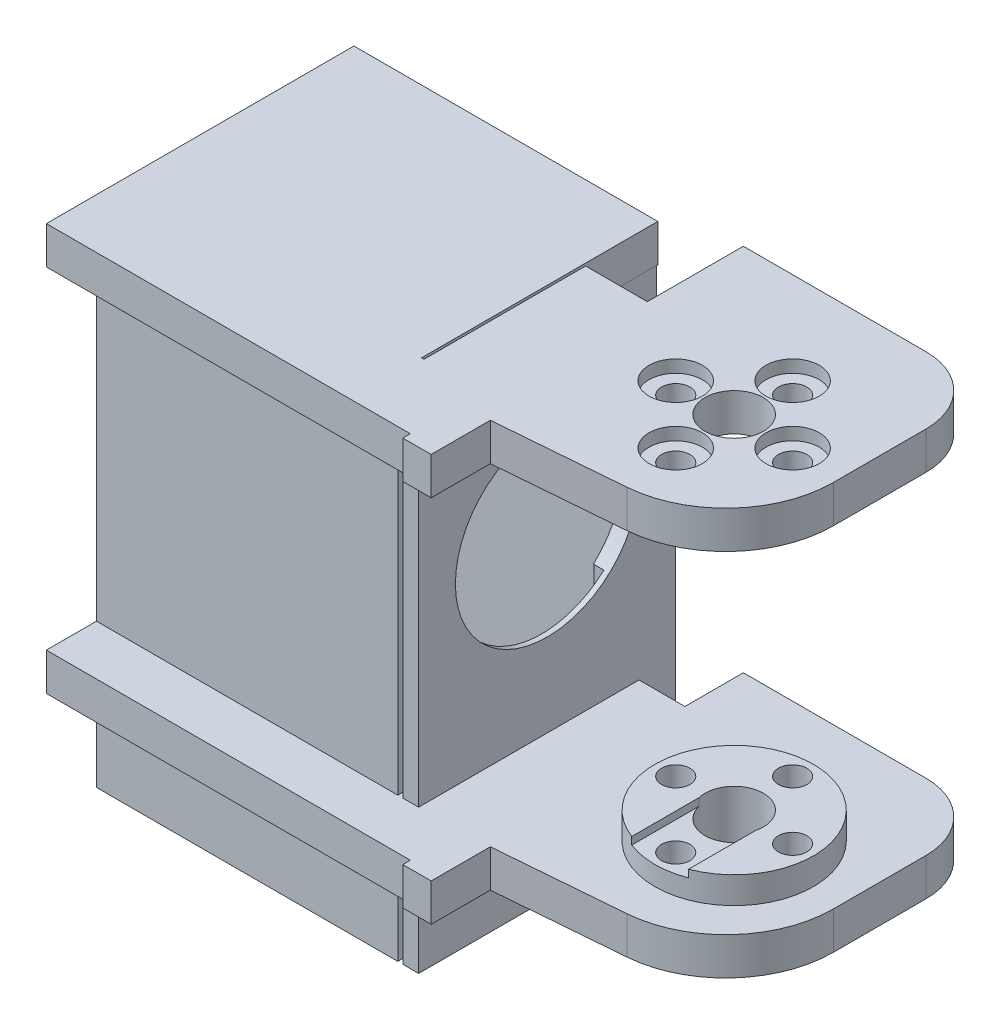
from build123d import *

# Parameters (mm, degrees)
BOSS_1_DEPTH    = 4.5
S_CYL2_R        = 9.5
BOSS_2_DEPTH    = 3.2
BOSS_3_DEPTH    = 4.5
S_PRISM4_W      = 7.5
S_PRISM4_H      = 21.95
BOSS_4_DEPTH    = 4.5
S_PRISM5_W      = 44.2
S_PRISM5_H      = 8.55
BOSS_5_DEPTH    = 4.5
S_PRISM6_W      = 36.4
S_PRISM6_H      = 30.9
BOSS_6_DEPTH    = 4.5
S_PRISM7_W      = 3.4
S_PRISM7_H      = 7.9
BOSS_7_DEPTH    = 4.5
S_PRISM8_W      = 7.5
S_PRISM8_H      = 26.45
BOSS_8_DEPTH    = 4.5
S_PRISM9_W      = 44.2
S_PRISM9_H      = 8.55
BOSS_9_DEPTH    = 4.5
S_PRISM10_W     = 3.4
S_PRISM10_H     = 7.9
BOSS_10_DEPTH   = 4.5
S_BOX11_W       = 36.1
S_BOX11_H       = 2.5
BOSS_11_DEPTH   = 30.8
S_BOX12_W       = 36.1
S_BOX12_H       = 51.4
BOSS_12_DEPTH   = 2.5
S_BOX13_W       = 36.1
S_BOX13_H       = 51.4
BOSS_13_DEPTH   = 2.5
S_BOX14_W       = 4.6
S_BOX14_H       = 51.4
BOSS_14_DEPTH   = 30.8
S_BOX15_W       = 1.9
S_BOX15_H       = 54.1
BOSS_15_DEPTH   = 30.8
S_BOX16_W       = 36.26
S_BOX16_H       = 6
BOSS_16_DEPTH   = 30.76
S_HOLE17_R      = 3.5
HOLE_17_DEPTH   = 4.7
S_HOLE18_R      = 1.7
HOLE_18_DEPTH   = 4.7
S_HOLE19_R      = 1.7
HOLE_19_DEPTH   = 4.7
S_HOLE20_R      = 1.7
HOLE_20_DEPTH   = 4.7
S_HOLE21_R      = 1.7
HOLE_21_DEPTH   = 4.7
S_HOLE22_R      = 3.2
HOLE_22_DEPTH   = 1.6
S_HOLE23_R      = 3.2
HOLE_23_DEPTH   = 1.6
S_HOLE24_R      = 3.2
HOLE_24_DEPTH   = 1.6
S_HOLE25_R      = 3.2
HOLE_25_DEPTH   = 1.6
S_HOLE26_R      = 3.5
HOLE_26_DEPTH   = 7.9
S_HOLE27_R      = 1.7
HOLE_27_DEPTH   = 7.9
S_HOLE28_R      = 1.7
HOLE_28_DEPTH   = 7.9
S_HOLE29_R      = 1.7
HOLE_29_DEPTH   = 7.9
S_HOLE30_R      = 1.7
HOLE_30_DEPTH   = 7.9
S_HOLE31_R      = 3.2
HOLE_31_DEPTH   = 2.1
S_HOLE32_R      = 3.2
HOLE_32_DEPTH   = 2.1
S_HOLE33_R      = 3.2
HOLE_33_DEPTH   = 2.1
S_HOLE34_R      = 3.2
HOLE_34_DEPTH   = 2.1
S_CUT35_W       = 6.8
S_CUT35_H       = 1
POCKET_35_DEPTH = 10
S_HOLE36_R      = 10.5
HOLE_36_DEPTH   = 4.8
S_CUT37_W       = 4.75
S_CUT37_H       = 19.5
POCKET_37_DEPTH = 19.4
S_CUT38_W       = 4.75
S_CUT38_H       = 8.3
POCKET_38_DEPTH = 19.4
S_CUT39_W       = 4.75
S_CUT39_H       = 11
POCKET_39_DEPTH = 7
S_CUT40_W       = 2.9
S_CUT40_H       = 20
POCKET_40_DEPTH = 15.9
S_HOLE41_R      = 1.1
HOLE_41_DEPTH   = 4.8
S_HOLE42_R      = 2.3
HOLE_42_DEPTH   = 1.7
S_HOLE43_R      = 1.1
HOLE_43_DEPTH   = 4.8
S_HOLE44_R      = 2.3
HOLE_44_DEPTH   = 1.7
S_HOLE45_R      = 1.1
HOLE_45_DEPTH   = 4.8
S_HOLE46_R      = 2.3
HOLE_46_DEPTH   = 1.7
S_HOLE47_R      = 11
HOLE_47_DEPTH   = 2.7
S_CUT48_W       = 1.85
S_CUT48_H       = 30.6
POCKET_48_DEPTH = 15
CUT_49_DEPTH    = 36.3


with BuildPart() as part:
    # S_prism1 → Boss_1 (new body)
    with BuildSketch(Plane(origin=(0, 18.8, 0), x_dir=(1, 0, 0), z_dir=(0, 1, 0))):
        with BuildLine():
            Line((13, 10), (13, -1.1138))
            ThreePointArc((13, -1.1138), (9.586829994, -9.855067448), (1.1535, -13.9707))
            Line((1.1535, -13.9707), (-16.9, -15.45))
            Line((-16.9, -15.45), (-16.9, 18))
            Line((-16.9, 18), (5, 18))
            ThreePointArc((5, 18), (10.6569, 15.6569), (13, 10))
        make_face()
    extrude(amount=BOSS_1_DEPTH)

    # S_prism4 → Boss_4 (add)
    with BuildSketch(Plane(origin=(0, 18.8, 0), x_dir=(1, 0, 0), z_dir=(0, 1, 0))):
        with Locations((-20.55, -4.475)):
            Rectangle(S_PRISM4_W, S_PRISM4_H)
    extrude(amount=BOSS_4_DEPTH)

    # S_prism5 → Boss_5 (add)
    with BuildSketch(Plane(origin=(0, 18.8, 0), x_dir=(1, 0, 0), z_dir=(0, 1, 0))):
        with Locations((-38.9, -17.125)):
            Rectangle(S_PRISM5_W, S_PRISM5_H)
    extrude(amount=BOSS_5_DEPTH)

    # S_prism6 → Boss_6 (add)
    with BuildSketch(Plane(origin=(0, 18.8, 0), x_dir=(1, 0, 0), z_dir=(0, 1, 0))):
        with Locations((-42.8, 0)):
            Rectangle(S_PRISM6_W, S_PRISM6_H)
    extrude(amount=BOSS_6_DEPTH)

    # S_prism7 → Boss_7 (add)
    with BuildSketch(Plane(origin=(0, 18.8, 0), x_dir=(1, 0, 0), z_dir=(0, 1, 0))):
        with Locations((-15.7, -18.35)):
            Rectangle(S_PRISM7_W, S_PRISM7_H)
    extrude(amount=BOSS_7_DEPTH)



with BuildPart() as body_2:
    # S_cyl2 → Boss_2 (new body)
    with BuildSketch(Plane(origin=(0, -20.95, 0), x_dir=(1, 0, 0), z_dir=(0, 1, 0))):
        Circle(S_CYL2_R)
    extrude(amount=BOSS_2_DEPTH)

    # S_prism3 → Boss_3 (add)
    with BuildSketch(Plane(origin=(0, -25.45, 0), x_dir=(1, 0, 0), z_dir=(0, 1, 0))):
        with BuildLine():
            Line((13, 10), (13, -1.1138))
            ThreePointArc((13, -1.1138), (9.586829994, -9.855067448), (1.1535, -13.9707))
            Line((1.1535, -13.9707), (-16.9, -15.45))
            Line((-16.9, -15.45), (-16.9, 18))
            Line((-16.9, 18), (5, 18))
            ThreePointArc((5, 18), (10.6569, 15.6569), (13, 10))
        make_face()
    extrude(amount=BOSS_3_DEPTH)

    # S_prism8 → Boss_8 (add)
    with BuildSketch(Plane(origin=(0, -25.45, 0), x_dir=(1, 0, 0), z_dir=(0, 1, 0))):
        with Locations((-20.55, -2.225)):
            Rectangle(S_PRISM8_W, S_PRISM8_H)
    extrude(amount=BOSS_8_DEPTH)

    # S_prism9 → Boss_9 (add)
    with BuildSketch(Plane(origin=(0, -25.45, 0), x_dir=(1, 0, 0), z_dir=(0, 1, 0))):
        with Locations((-38.9, -17.125)):
            Rectangle(S_PRISM9_W, S_PRISM9_H)
    extrude(amount=BOSS_9_DEPTH)

    # S_prism10 → Boss_10 (add)
    with BuildSketch(Plane(origin=(0, -25.45, 0), x_dir=(1, 0, 0), z_dir=(0, 1, 0))):
        with Locations((-15.7, -18.35)):
            Rectangle(S_PRISM10_W, S_PRISM10_H)
    extrude(amount=BOSS_10_DEPTH)



with BuildPart() as body_3:
    # S_box11 → Boss_11 (new body)
    with BuildSketch(Plane.XY.offset(-15.4)):
        with Locations((-42.95, 11.95)):
            Rectangle(S_BOX11_W, S_BOX11_H)
    extrude(amount=BOSS_11_DEPTH)

    # S_box12 → Boss_12 (add)
    with BuildSketch(Plane.XY.offset(-15.4)):
        with Locations((-42.95, -12.5)):
            Rectangle(S_BOX12_W, S_BOX12_H)
    extrude(amount=BOSS_12_DEPTH)


with BuildPart() as body_2_1:
    add(body_2.part)

    add(body_3.part)  # Boss_13 merges body 3
    # S_box13 → Boss_13 (add)
    with BuildSketch(Plane.XY.offset(12.9)):
        with Locations((-42.95, -12.5)):
            Rectangle(S_BOX13_W, S_BOX13_H)
    extrude(amount=BOSS_13_DEPTH)

    # S_box14 → Boss_14 (add)
    with BuildSketch(Plane.XY.offset(-15.4)):
        with Locations((-58.7, -12.5)):
            Rectangle(S_BOX14_W, S_BOX14_H)
    extrude(amount=BOSS_14_DEPTH)

    # S_box15 → Boss_15 (add)
    with BuildSketch(Plane.XY.offset(-15.4)):
        with Locations((-23.35, -11.15)):
            Rectangle(S_BOX15_W, S_BOX15_H)
    extrude(amount=BOSS_15_DEPTH)


with BuildPart() as part_1:
    add(part.part)

    add(body_2_1.part)  # Boss_16 merges body 2
    # S_box16 → Boss_16 (add)
    with BuildSketch(Plane.XY.offset(-15.38)):
        with Locations((-42.8, 15.9)):
            Rectangle(S_BOX16_W, S_BOX16_H)
    extrude(amount=BOSS_16_DEPTH)

    # S_hole17 → Hole_17 (cut)
    with BuildSketch(Plane(origin=(0, 18.7, 0), x_dir=(1, 0, 0), z_dir=(0, 1, 0))):
        Circle(S_HOLE17_R)
    extrude(amount=HOLE_17_DEPTH, mode=Mode.SUBTRACT)

    # S_hole18 → Hole_18 (cut)
    with BuildSketch(Plane(origin=(0, 18.7, 0), x_dir=(1, 0, 0), z_dir=(0, 1, 0))):
        with Locations((7, 0)):
            Circle(S_HOLE18_R)
    extrude(amount=HOLE_18_DEPTH, mode=Mode.SUBTRACT)

    # S_hole19 → Hole_19 (cut)
    with BuildSketch(Plane(origin=(0, 18.7, 0), x_dir=(1, 0, 0), z_dir=(0, 1, 0))):
        with Locations((0, -7)):
            Circle(S_HOLE19_R)
    extrude(amount=HOLE_19_DEPTH, mode=Mode.SUBTRACT)

    # S_hole20 → Hole_20 (cut)
    with BuildSketch(Plane(origin=(0, 18.7, 0), x_dir=(1, 0, 0), z_dir=(0, 1, 0))):
        with Locations((-7, 0)):
            Circle(S_HOLE20_R)
    extrude(amount=HOLE_20_DEPTH, mode=Mode.SUBTRACT)

    # S_hole21 → Hole_21 (cut)
    with BuildSketch(Plane(origin=(0, 18.7, 0), x_dir=(1, 0, 0), z_dir=(0, 1, 0))):
        with Locations((0, 7)):
            Circle(S_HOLE21_R)
    extrude(amount=HOLE_21_DEPTH, mode=Mode.SUBTRACT)

    # S_hole22 → Hole_22 (cut)
    with BuildSketch(Plane(origin=(0, 21.8, 0), x_dir=(1, 0, 0), z_dir=(0, 1, 0))):
        with Locations((7, 0)):
            Circle(S_HOLE22_R)
    extrude(amount=HOLE_22_DEPTH, mode=Mode.SUBTRACT)

    # S_hole23 → Hole_23 (cut)
    with BuildSketch(Plane(origin=(0, 21.8, 0), x_dir=(1, 0, 0), z_dir=(0, 1, 0))):
        with Locations((0, -7)):
            Circle(S_HOLE23_R)
    extrude(amount=HOLE_23_DEPTH, mode=Mode.SUBTRACT)

    # S_hole24 → Hole_24 (cut)
    with BuildSketch(Plane(origin=(0, 21.8, 0), x_dir=(1, 0, 0), z_dir=(0, 1, 0))):
        with Locations((-7, 0)):
            Circle(S_HOLE24_R)
    extrude(amount=HOLE_24_DEPTH, mode=Mode.SUBTRACT)

    # S_hole25 → Hole_25 (cut)
    with BuildSketch(Plane(origin=(0, 21.8, 0), x_dir=(1, 0, 0), z_dir=(0, 1, 0))):
        with Locations((0, 7)):
            Circle(S_HOLE25_R)
    extrude(amount=HOLE_25_DEPTH, mode=Mode.SUBTRACT)

    # S_hole26 → Hole_26 (cut)
    with BuildSketch(Plane(origin=(0, -25.55, 0), x_dir=(1, 0, 0), z_dir=(0, 1, 0))):
        Circle(S_HOLE26_R)
    extrude(amount=HOLE_26_DEPTH, mode=Mode.SUBTRACT)

    # S_hole27 → Hole_27 (cut)
    with BuildSketch(Plane(origin=(0, -25.55, 0), x_dir=(1, 0, 0), z_dir=(0, 1, 0))):
        with Locations((7, 0)):
            Circle(S_HOLE27_R)
    extrude(amount=HOLE_27_DEPTH, mode=Mode.SUBTRACT)

    # S_hole28 → Hole_28 (cut)
    with BuildSketch(Plane(origin=(0, -25.55, 0), x_dir=(1, 0, 0), z_dir=(0, 1, 0))):
        with Locations((0, -7)):
            Circle(S_HOLE28_R)
    extrude(amount=HOLE_28_DEPTH, mode=Mode.SUBTRACT)

    # S_hole29 → Hole_29 (cut)
    with BuildSketch(Plane(origin=(0, -25.55, 0), x_dir=(1, 0, 0), z_dir=(0, 1, 0))):
        with Locations((-7, 0)):
            Circle(S_HOLE29_R)
    extrude(amount=HOLE_29_DEPTH, mode=Mode.SUBTRACT)

    # S_hole30 → Hole_30 (cut)
    with BuildSketch(Plane(origin=(0, -25.55, 0), x_dir=(1, 0, 0), z_dir=(0, 1, 0))):
        with Locations((0, 7)):
            Circle(S_HOLE30_R)
    extrude(amount=HOLE_30_DEPTH, mode=Mode.SUBTRACT)

    # S_hole31 → Hole_31 (cut)
    with BuildSketch(Plane(origin=(0, -25.55, 0), x_dir=(1, 0, 0), z_dir=(0, 1, 0))):
        with Locations((7, 0)):
            Circle(S_HOLE31_R)
    extrude(amount=HOLE_31_DEPTH, mode=Mode.SUBTRACT)

    # S_hole32 → Hole_32 (cut)
    with BuildSketch(Plane(origin=(0, -25.55, 0), x_dir=(1, 0, 0), z_dir=(0, 1, 0))):
        with Locations((0, -7)):
            Circle(S_HOLE32_R)
    extrude(amount=HOLE_32_DEPTH, mode=Mode.SUBTRACT)

    # S_hole33 → Hole_33 (cut)
    with BuildSketch(Plane(origin=(0, -25.55, 0), x_dir=(1, 0, 0), z_dir=(0, 1, 0))):
        with Locations((-7, 0)):
            Circle(S_HOLE33_R)
    extrude(amount=HOLE_33_DEPTH, mode=Mode.SUBTRACT)

    # S_hole34 → Hole_34 (cut)
    with BuildSketch(Plane(origin=(0, -25.55, 0), x_dir=(1, 0, 0), z_dir=(0, 1, 0))):
        with Locations((0, 7)):
            Circle(S_HOLE34_R)
    extrude(amount=HOLE_34_DEPTH, mode=Mode.SUBTRACT)

    # S_cut35 → Pocket_35 (cut)
    with BuildSketch(Plane.XY):
        with Locations((0, -18.15)):
            Rectangle(S_CUT35_W, S_CUT35_H)
    extrude(amount=POCKET_35_DEPTH, mode=Mode.SUBTRACT)

    # S_hole36 → Hole_36 (cut)
    with BuildSketch(Plane(origin=(-61.1, 0, 0), x_dir=(0, 0, -1), z_dir=(1, 0, 0))):
        Circle(S_HOLE36_R)
    extrude(amount=HOLE_36_DEPTH, mode=Mode.SUBTRACT)

    # S_cut37 → Pocket_37 (cut)
    with BuildSketch(Plane.XY.offset(-9.7)):
        with Locations((-58.725, -20.65)):
            Rectangle(S_CUT37_W, S_CUT37_H)
    extrude(amount=POCKET_37_DEPTH, mode=Mode.SUBTRACT)

    # S_cut38 → Pocket_38 (cut)
    with BuildSketch(Plane.XY.offset(-9.7)):
        with Locations((-58.725, -34.55)):
            Rectangle(S_CUT38_W, S_CUT38_H)
    extrude(amount=POCKET_38_DEPTH, mode=Mode.SUBTRACT)

    # S_cut39 → Pocket_39 (cut)
    with BuildSketch(Plane.XY.offset(-3.5)):
        with Locations((-58.725, -5.5)):
            Rectangle(S_CUT39_W, S_CUT39_H)
    extrude(amount=POCKET_39_DEPTH, mode=Mode.SUBTRACT)

    # S_cut40 → Pocket_40 (cut)
    with BuildSketch(Plane.XY.offset(-15.9)):
        with Locations((-59.75, 0)):
            Rectangle(S_CUT40_W, S_CUT40_H)
    extrude(amount=POCKET_40_DEPTH, mode=Mode.SUBTRACT)

    # S_hole41 → Hole_41 (cut)
    with BuildSketch(Plane(origin=(-61.1, 0, 0), x_dir=(0, 0, -1), z_dir=(1, 0, 0))):
        with Locations((-10.25, -8.3)):
            Circle(S_HOLE41_R)
    extrude(amount=HOLE_41_DEPTH, mode=Mode.SUBTRACT)

    # S_hole42 → Hole_42 (cut)
    with BuildSketch(Plane(origin=(-61.1, 0, 0), x_dir=(0, 0, -1), z_dir=(1, 0, 0))):
        with Locations((-10.25, -8.3)):
            Circle(S_HOLE42_R)
    extrude(amount=HOLE_42_DEPTH, mode=Mode.SUBTRACT)

    # S_hole43 → Hole_43 (cut)
    with BuildSketch(Plane(origin=(-61.1, 0, 0), x_dir=(0, 0, -1), z_dir=(1, 0, 0))):
        with Locations((10.25, -32.75)):
            Circle(S_HOLE43_R)
    extrude(amount=HOLE_43_DEPTH, mode=Mode.SUBTRACT)

    # S_hole44 → Hole_44 (cut)
    with BuildSketch(Plane(origin=(-61.1, 0, 0), x_dir=(0, 0, -1), z_dir=(1, 0, 0))):
        with Locations((10.25, -32.75)):
            Circle(S_HOLE44_R)
    extrude(amount=HOLE_44_DEPTH, mode=Mode.SUBTRACT)

    # S_hole45 → Hole_45 (cut)
    with BuildSketch(Plane(origin=(-61.1, 0, 0), x_dir=(0, 0, -1), z_dir=(1, 0, 0))):
        with Locations((-10.25, -32.75)):
            Circle(S_HOLE45_R)
    extrude(amount=HOLE_45_DEPTH, mode=Mode.SUBTRACT)

    # S_hole46 → Hole_46 (cut)
    with BuildSketch(Plane(origin=(-61.1, 0, 0), x_dir=(0, 0, -1), z_dir=(1, 0, 0))):
        with Locations((-10.25, -32.75)):
            Circle(S_HOLE46_R)
    extrude(amount=HOLE_46_DEPTH, mode=Mode.SUBTRACT)

    # S_hole47 → Hole_47 (cut)
    with BuildSketch(Plane(origin=(-25, 0, 0), x_dir=(0, 0, -1), z_dir=(1, 0, 0))):
        Circle(S_HOLE47_R)
    extrude(amount=HOLE_47_DEPTH, mode=Mode.SUBTRACT)

    # S_cut48 → Pocket_48 (cut)
    with BuildSketch(Plane.XY.offset(-7.5)):
        with Locations((-23.975, -23.4)):
            Rectangle(S_CUT48_W, S_CUT48_H)
    extrude(amount=POCKET_48_DEPTH, mode=Mode.SUBTRACT)

    # S_pcut49 → Cut_49 (cut)
    with BuildSketch(Plane(origin=(-61.1, 0, 0), x_dir=(0, 0, -1), z_dir=(1, 0, 0))):
        Polygon((16, -38.8), (16, -28.6), (5.8, -38.8), align=None)
    extrude(amount=CUT_49_DEPTH, mode=Mode.SUBTRACT)


solid = part_1.part
